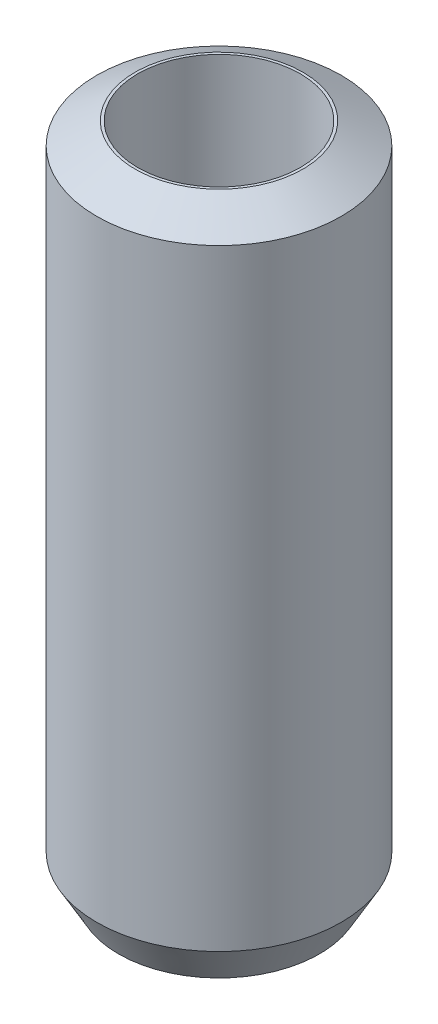
from build123d import *
from OCP.BRepFilletAPI import BRepFilletAPI_MakeChamfer

# Parameters (mm, degrees)
SKETCH1_R           = 10
BOSS_EXTRUDE1_DEPTH = 54.926538411
SKETCH2_R           = 6.64897859
CUT_EXTRUDE1_DEPTH  = 57.717939154
CHAMFER1_SIZE       = 1.780617956
CHAMFER1_SIZE2      = 3.131120035


with BuildPart() as part:
    # Sketch1 → Boss-Extrude1 (new body)
    with BuildSketch(Plane(origin=(0, 0, 0), x_dir=(1, 0, 0), z_dir=(0, 1, 0))):
        Circle(SKETCH1_R)
    extrude(amount=BOSS_EXTRUDE1_DEPTH)

    # Sketch2 → Cut-Extrude1 (cut, through all)
    with BuildSketch(Plane(origin=(0, 0, 0), x_dir=(1, 0, 0), z_dir=(0, 1, 0))):
        Circle(SKETCH2_R)
    extrude(amount=CUT_EXTRUDE1_DEPTH, mode=Mode.SUBTRACT)

    # Chamfer1: one chamfer whose edges measure the first distance from different faces: ONE call of the kernel's chamfer builder (chamfer() names one face for all edges)
    chamfer1_edges_1 = [part.edges().sort_by_distance(p)[0] for p in [
        (-10, 54.926538411, 0),
    ]]
    chamfer1_side_1 = [part.faces().sort_by_distance(p)[0] for p in [
        (-10, 27.463269206, 0),
    ]]
    chamfer1_edges_2 = [part.edges().sort_by_distance(p)[0] for p in [
        (-10, 0, 0),
    ]]
    chamfer1_side_2 = [part.faces().sort_by_distance(p)[0] for p in [
        (-9.717157288, 0, 0),
    ]]
    chamfer1 = BRepFilletAPI_MakeChamfer(part.part.solid().wrapped)
    for e in chamfer1_edges_1:
        chamfer1.Add(CHAMFER1_SIZE, CHAMFER1_SIZE2, e.wrapped, chamfer1_side_1[0].wrapped)  # the first distance lies on this face
    for e in chamfer1_edges_2:
        chamfer1.Add(CHAMFER1_SIZE, CHAMFER1_SIZE2, e.wrapped, chamfer1_side_2[0].wrapped)  # the first distance lies on this face
    add(Compound.cast(chamfer1.Shape()), mode=Mode.REPLACE)


solid = part.part
